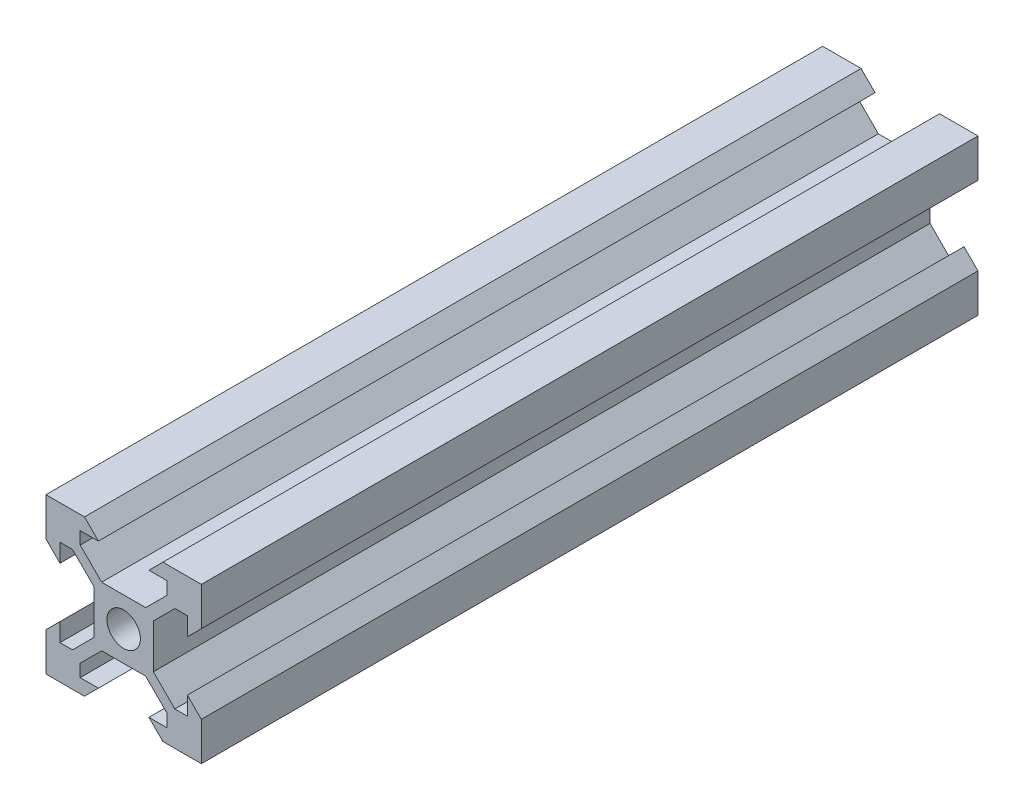
from build123d import *

# Parameters (mm, degrees)
CROQUIS1_R              = 2.15
SALIENTE_EXTRUIR2_DEPTH = 100


with BuildPart() as part:
    # Croquis1 → Saliente-Extruir2 (new body)
    with BuildSketch(Plane.XY):
        Polygon((4.4, 0), (0, 0), (0, -0.56736664), (0, -4.4), (0, -4.95), (1.8, -6.75), (1.8, -4.4), (3.410050506, -4.4), (6.175, -7.164949494), (6.175, -12.835050506), (3.410050506, -15.6), (1.8, -15.6), (1.8, -13.25), (0, -15.05), (0, -15.6), (0, -20), (4.4, -20), (4.95, -20), (6.75, -18.2), (4.4, -18.2), (4.4, -16.589949494), (7.164949494, -13.825), (12.835050506, -13.825), (15.6, -16.589949494), (15.6, -18.2), (13.25, -18.2), (15.05, -20), (15.6, -20), (18.2, -20), (20, -20), (20, -15.6), (20, -15.05), (18.2, -13.25), (18.2, -15.6), (16.589949494, -15.6), (13.825, -12.835050506), (13.825, -7.164949494), (16.589949494, -4.4), (18.2, -4.4), (18.2, -6.75), (20, -4.95), (20, -4.4), (20, 0), (15.6, 0), (15.05, 0), (13.25, -1.8), (15.6, -1.8), (15.6, -3.410050506), (12.835050506, -6.175), (7.164949494, -6.175), (4.4, -3.410050506), (4.4, -1.8), (6.75, -1.8), (4.95, 0), align=None)
        with Locations((10, -10)):
            Circle(CROQUIS1_R, mode=Mode.SUBTRACT)
    extrude(amount=SALIENTE_EXTRUIR2_DEPTH)


solid = part.part
